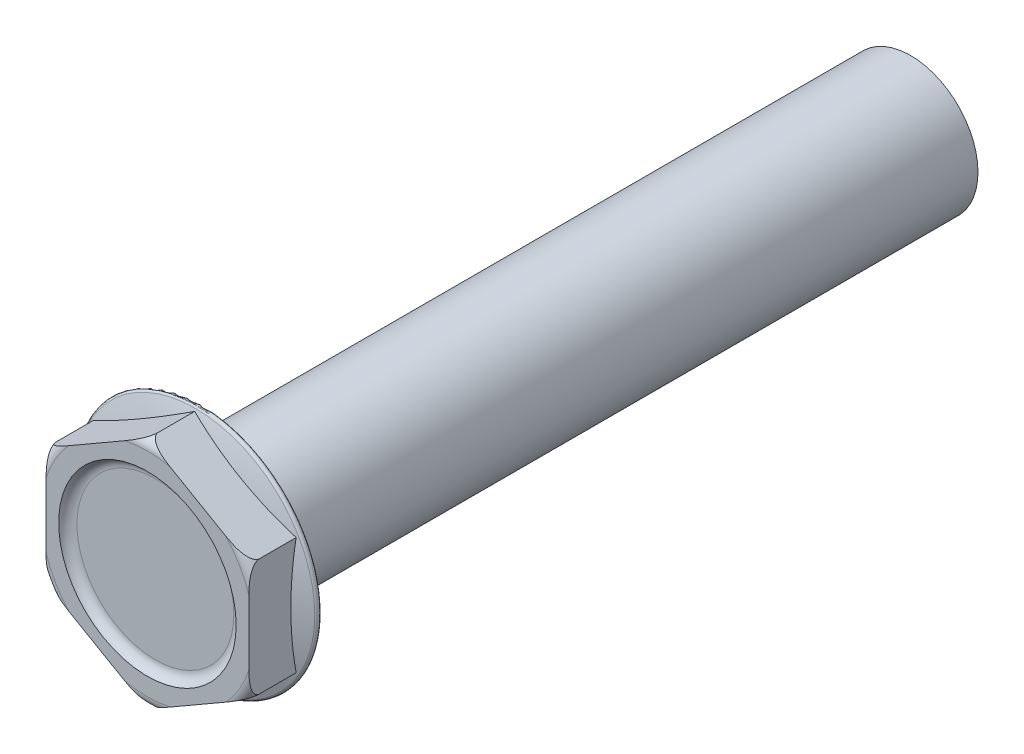
from build123d import *

# Parameters (mm, degrees)
HEAD_DEPTH     = 10
SHANK_SKETCH_R = 12.7
SHANK_DEPTH    = 133.35
SKETCH6_R      = 16.66875
HEAD_CUT_DEPTH = 1.5
FILLET1_R      = 2
FILLET2_R      = 0.5
THREAD_END_W   = 127
THREAD_END_H   = 0.05


with BuildPart() as part:
    # Head Sketch → Head (new body)
    with BuildSketch(Plane.XY):
        Polygon((0, 21.997045256), (19.05, 10.998522628), (19.05, -10.998522628), (0, -21.997045256), (-19.05, -10.998522628), (-19.05, 10.998522628), align=None)
    extrude(amount=HEAD_DEPTH)

    # Shank Sketch → Shank (add)
    with BuildSketch(Plane.XY):
        Circle(SHANK_SKETCH_R)
    extrude(amount=-SHANK_DEPTH)

    # Sketch3 → Flange (revolve)
    with BuildSketch(Plane(origin=(0, 0, 0), x_dir=(-1, 0, 0), z_dir=(0, 1, 0)), mode=Mode.PRIVATE) as flange_sk:
        with BuildLine():
            Line((-22.225, 0), (0, 0))
            Line((0, 0), (0, 5))
            ThreePointArc((0, 5), (-11.379608963, 3.984124175), (-22.399330603, 0.968624413))
            ThreePointArc((-22.399330603, 0.968624413), (-22.717093592, 0.411434224), (-22.225, 0))
        make_face()
    revolve(flange_sk.sketch.rotate(Axis((0, 0, 0), (0, 0, 1)), 30), axis=Axis((0, 0, 0), (0, 0, 1)))

    # Sketch5 → Head Trim (revolve, cut)
    with BuildSketch(Plane(origin=(0, 0, 0), x_dir=(0, 0, -1), z_dir=(1, 0, 0)), mode=Mode.PRIVATE) as head_trim_sk:
        with BuildLine():
            Line((-10, -19.997045256), (-10, -21.997045256))
            Line((-10, -21.997045256), (-8, -21.997045256))
            ThreePointArc((-8, -21.997045256), (-9.414213562, -21.411258818), (-10, -19.997045256))
        make_face()
    revolve(head_trim_sk.sketch.rotate(Axis((0, 0, 15.085599173), (0, 0, -1)), 90), axis=Axis((0, 0, 15.085599173), (0, 0, -1)), mode=Mode.SUBTRACT)

    # Sketch6 → Head Cut (cut)
    with BuildSketch(Plane.XY.offset(10)):
        Circle(SKETCH6_R)
    extrude(amount=-HEAD_CUT_DEPTH, mode=Mode.SUBTRACT)

    # Fillet1
    # the kernel refuses this fillet: 2 mm, written as the material it adds along each edge
    with BuildSketch(Plane(origin=(0, 0, 8.5), x_dir=(1, 0, 0), z_dir=(0, -1, 0))) as fillet1_piece_1:
        with BuildLine():
            CenterArc((14.732258327, 2), FILLET1_R, 270, 75.522487814)
            Line((14.732258327, 0), (14.732258327, -0.04))
            Line((14.732258327, -0.04), (16.66875, -0.04))
            Line((16.66875, -0.04), (16.70875, 0))
            ThreePointArc((16.70875, 0), (16.70875, 0.75), (16.707479833, 1.49))
            Line((16.707479833, 1.49), (16.66875, 1.5))
        make_face()
    revolve(axis=Axis((0, 0, 8.5), (0, 0, 1)))

    # Fillet2
    fillet2_edges = [part.edges().sort_by_distance(p)[0] for p in [
        (-12.7, 0, 0),
    ]]
    fillet(fillet2_edges, radius=FILLET2_R)

    # Thread End → Thread Cut (revolve, cut)
    with BuildSketch(Plane(origin=(0, 0, 0), x_dir=(0, 0, -1), z_dir=(1, 0, 0)), mode=Mode.PRIVATE) as thread_cut_sk:
        with Locations((69.85, 12.675)):
            Rectangle(THREAD_END_W, THREAD_END_H)
    revolve(thread_cut_sk.sketch.rotate(Axis((0, 0, -21.551935625), (0, 0, -1)), 90), axis=Axis((0, 0, -21.551935625), (0, 0, -1)), mode=Mode.SUBTRACT)


solid = part.part
